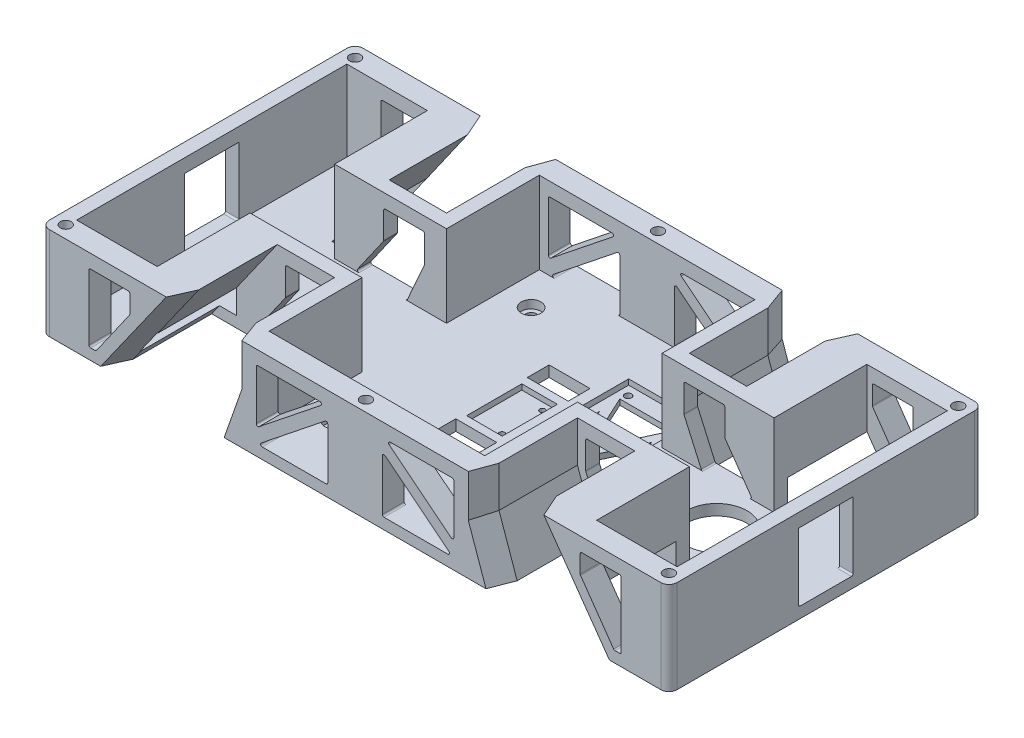
from build123d import *

# Parameters (mm, degrees)
EXTRUDE_1_DEPTH          = 5
EXTRUDE_3_DEPTH          = 35
EXTRUDE_6_DEPTH          = 37
EXTRUDE_7_DEPTH          = 37
SKETCH_6_W               = 20
SKETCH_6_H               = 25
CUT_EXTRUDE_3_DEPTH      = 240.64817963
CUT_EXTRUDE_1_DEPTH      = 133.027459265
CUT_EXTRUDE_1_DEPTH_BACK = 2
SKETCH_4_W               = 25.5
SKETCH_4_H               = 62.5
SKETCH_4_W_2             = 13
SKETCH_4_H_2             = 20.2
CUT_EXTRUDE_17_DEPTH     = 37
CUT_EXTRUDE_24_DEPTH     = 37
CHAMFER_2_SIZE           = 8.242432258
CHAMFER_2_SIZE_2         = 3
CUT_EXTRUDE_START        = -115
CUT_EXTRUDE_2_DEPTH      = 115
FILLET_1_R               = 3
SKETCH_8_R               = 2
CUT_EXTRUDE_4_DEPTH      = 10
SKETCH_12_R              = 1.25
SKETCH_12_R_2            = 1
CUT_EXTRUDE_8_DEPTH      = 2.5
SKETCH_14_R              = 11.1
SKETCH_14_R_2            = 2
SKETCH_14_W              = 15
SKETCH_14_H              = 8
CUT_EXTRUDE_9_DEPTH      = 133.027459265
SKETCH_19_R              = 3.6
CUT_EXTRUDE_12_DEPTH     = 3
FILLET_11_R              = 0.6
SKETCH_24_W              = 230
SKETCH_24_H              = 115
CUT_EXTRUDE_26_DEPTH     = 1


# Read off the part's stored shape, not the designer's step: 除料-伸長2
with BuildPart() as part:
    # 草圖1 → 填料-伸長1 (new body)
    with BuildSketch(Plane(origin=(0, 0, 0), x_dir=(1, 0, 0), z_dir=(0, 1, 0))):
        Polygon((-115, -57.5), (-65.5, -57.5), (-65.5, -20.5), (-44.5, -20.5), (-44.5, -57.5), (44.5, -57.5), (44.5, -20.5), (65.5, -20.5), (65.5, -57.5), (115, -57.5), (115, 57.5), (65.5, 57.5), (65.5, 20.5), (44.5, 20.5), (44.5, 57.5), (-44.5, 57.5), (-44.5, 20.5), (-65.5, 20.5), (-65.5, 57.5), (-115, 57.5), align=None)
    extrude(amount=EXTRUDE_1_DEPTH)

    # 草圖3 → 填料-伸長3 (add)
    with BuildSketch(Plane(origin=(0, 0, 0), x_dir=(1, 0, 0), z_dir=(0, 1, 0))):
        Polygon((115, 57.5), (65.5, 57.5), (65.5, 20.5), (44.5, 20.5), (44.5, 57.5), (-44.5, 57.5), (-44.5, 20.5), (-65.5, 20.5), (-65.5, 57.5), (-115, 57.5), (-115, -57.5), (-65.5, -57.5), (-65.5, -20.5), (-44.5, -20.5), (-44.5, -57.5), (44.5, -57.5), (44.5, -20.5), (65.5, -20.5), (65.5, -57.5), (115, -57.5), align=None)
        Polygon((110, 49.5), (80.5, 49.5), (80.5, 15.5), (39.5, 15.5), (39.5, 49.5), (-39.5, 49.5), (-39.5, 15.5), (-80.5, 15.5), (-80.5, 49.5), (-110, 49.5), (-110, -49.5), (-80.5, -49.5), (-80.5, -15.5), (-39.5, -15.5), (-39.5, -49.5), (39.5, -49.5), (39.5, -15.5), (80.5, -15.5), (80.5, -49.5), (110, -49.5), align=None, mode=Mode.SUBTRACT)
    extrude(amount=EXTRUDE_3_DEPTH)

    # 草圖18 → 填料-伸長6 (add)
    with BuildSketch(Plane.XY.offset(20.5)):
        Polygon((44.5, 0), (51.5, 0), (44.5, 20), align=None)
        Polygon((-44.5, 0), (-51.5, 0), (-44.5, 20), align=None)
    extrude(amount=EXTRUDE_6_DEPTH)

    # 草圖20 → 填料-伸長7 (add)
    with BuildSketch(Plane(origin=(0, 0, -20.5), x_dir=(-1, 0, 0), z_dir=(0, 0, -1))):
        Polygon((44.5, 20), (44.5, 0), (51.5, 0), align=None)
        Polygon((-44.5, 0), (-51.5, 0), (-44.5, 20), align=None)
    extrude(amount=EXTRUDE_7_DEPTH)

    # 草圖6 → 除料-伸長3 (cut, through all)
    with BuildSketch(Plane.ZY.offset(115)):
        with Locations((0, 17.5)):
            Rectangle(SKETCH_6_W, SKETCH_6_H)
    extrude(amount=-CUT_EXTRUDE_3_DEPTH, mode=Mode.SUBTRACT)

    # 草圖4 → 除料-伸長1 (cut, two sides: drawn at the far end of the back side and taken through both)
    with BuildSketch(Plane(origin=(0, 5, 0), x_dir=(1, 0, 0), z_dir=(0, 1, 0)).offset(-CUT_EXTRUDE_1_DEPTH_BACK)):
        with Locations((24.25, 0)):
            Rectangle(SKETCH_4_W, SKETCH_4_H)
        Rectangle(SKETCH_4_W_2, SKETCH_4_H_2)
    extrude(amount=CUT_EXTRUDE_1_DEPTH + CUT_EXTRUDE_1_DEPTH_BACK, mode=Mode.SUBTRACT)

    # 草圖21 → 除料-伸長17 (cut)
    with BuildSketch(Plane.XY.offset(57.5)):
        Polygon((65.5, 35), (90.217350695, 0), (65.5, -0.099274728), align=None)
        Polygon((-90.217350695, 0), (-65.5, -0.099274728), (-65.5, 35), align=None)
    extrude(amount=-CUT_EXTRUDE_17_DEPTH, mode=Mode.SUBTRACT)

    # 草圖22 → 除料-伸長24 (cut)
    with BuildSketch(Plane(origin=(0, 0, -20.5), x_dir=(-1, 0, 0), z_dir=(0, 0, -1))):
        Polygon((-65.5, 35), (-90.007263837, 0), (-65.5, 0), align=None)
        Polygon((90.007263837, 0), (65.5, 0), (65.5, 35), align=None)
    extrude(amount=CUT_EXTRUDE_24_DEPTH, mode=Mode.SUBTRACT)

    # 導角2
    # the kernel refuses this chamfer: 8.242432258, 3 mm, written as the material it takes off along each edge
    with BuildSketch(Plane(origin=(44.5, -1.382474348, 57.5), x_dir=(0.013184058198645527, 0, -0.9999130865277316), z_dir=(0, 1, 0))) as chamfer_2_piece_1_section:
        Polygon((CHAMFER_2_SIZE * 0.999913086572, CHAMFER_2_SIZE * 0.0131840581992), (-CHAMFER_2_SIZE_2 * 0.0131840581986, CHAMFER_2_SIZE_2 * 0.999913086528), (0, 0), align=None)
    chamfer_2_piece_1 = extrude(amount=57.764948696, mode=Mode.PRIVATE)
    chamfer_2_piece_1 = split(chamfer_2_piece_1, bisect_by=Plane(origin=(38.345395508, 37.584584264, 54.601686025), z_dir=(0.9438583563660173, 0.3303504247281064, 0)), keep=Keep.TOP, mode=Mode.PRIVATE)
    add(chamfer_2_piece_1, mode=Mode.SUBTRACT)
    with BuildSketch(Plane(origin=(58.563709483, -20.182027093, 57.5), x_dir=(0.012443883501607477, 0.004355359225562621, -0.9999130865277316), z_dir=(-0.3303504247281064, 0.9438583563660173, 0))) as chamfer_2_piece_2_section:
        Polygon((CHAMFER_2_SIZE * 0.999913086572, CHAMFER_2_SIZE * 0.0131840581992), (-CHAMFER_2_SIZE_2 * 0.0131840581986, CHAMFER_2_SIZE_2 * 0.999913086528), (0, 0), align=None)
    chamfer_2_piece_2 = extrude(amount=63.954568797, mode=Mode.PRIVATE)
    chamfer_2_piece_2 = split(chamfer_2_piece_2, bisect_by=Plane(origin=(44.5, -1.565243843, 54.613777726), z_dir=(1, 0, 0)), keep=Keep.TOP, mode=Mode.PRIVATE)
    add(chamfer_2_piece_2, mode=Mode.SUBTRACT)
    with BuildSketch(Plane(origin=(-58.563709483, -20.182027093, 57.5), x_dir=(0.939217747619894, -0.3287262116669632, 0.09904090225204963), z_dir=(0.3303504247281064, 0.9438583563660173, 0))) as chamfer_2_piece_3_section:
        Polygon((CHAMFER_2_SIZE_2 * 0.995083363182, CHAMFER_2_SIZE_2 * 0.099040902252), (-CHAMFER_2_SIZE * 0.0990409022564, CHAMFER_2_SIZE * 0.995083363226), (0, 0), align=None)
    chamfer_2_piece_3 = extrude(amount=63.954568797, mode=Mode.PRIVATE)
    chamfer_2_piece_3 = split(chamfer_2_piece_3, bisect_by=Plane(origin=(-44.5, -1.565243843, 54.613777726), z_dir=(-1, 0, 0)), keep=Keep.TOP, mode=Mode.PRIVATE)
    add(chamfer_2_piece_3, mode=Mode.SUBTRACT)
    with BuildSketch(Plane(origin=(-44.5, -1.382474348, 57.5), x_dir=(0.9950833631817487, 0, 0.0990409022520496), z_dir=(0, 1, 0))) as chamfer_2_piece_4_section:
        Polygon((CHAMFER_2_SIZE_2 * 0.995083363182, CHAMFER_2_SIZE_2 * 0.099040902252), (-CHAMFER_2_SIZE * 0.0990409022564, CHAMFER_2_SIZE * 0.995083363226), (0, 0), align=None)
    chamfer_2_piece_4 = extrude(amount=57.764948696, mode=Mode.PRIVATE)
    chamfer_2_piece_4 = split(chamfer_2_piece_4, bisect_by=Plane(origin=(-38.345395508, 37.584584264, 54.601686025), z_dir=(-0.9438583563660173, 0.3303504247281064, 0)), keep=Keep.TOP, mode=Mode.PRIVATE)
    add(chamfer_2_piece_4, mode=Mode.SUBTRACT)
    with BuildSketch(Plane(origin=(-44.5, 56.382474348, -57.5), x_dir=(-0.013184058198645527, 0, 0.9999130865277316), z_dir=(0, -1, 0))) as chamfer_2_piece_5_section:
        Polygon((CHAMFER_2_SIZE * 0.999913086572, -CHAMFER_2_SIZE * 0.0131840581992), (-CHAMFER_2_SIZE_2 * 0.0131840581986, -CHAMFER_2_SIZE_2 * 0.999913086528), (0, 0), align=None)
    chamfer_2_piece_5 = extrude(amount=57.764948696, mode=Mode.PRIVATE)
    chamfer_2_piece_5 = split(chamfer_2_piece_5, bisect_by=Plane(origin=(-38.345395508, 37.584584264, -54.601686025), z_dir=(-0.9438583563660174, 0.33035042472810616, -3.991974397037747e-14)), keep=Keep.TOP, mode=Mode.PRIVATE)
    add(chamfer_2_piece_5, mode=Mode.SUBTRACT)
    with BuildSketch(Plane(origin=(44.5, 56.382474348, -57.5), x_dir=(-0.9950833631817487, 0, -0.0990409022520496), z_dir=(0, -1, 0))) as chamfer_2_piece_6_section:
        Polygon((CHAMFER_2_SIZE_2 * 0.995083363182, -CHAMFER_2_SIZE_2 * 0.099040902252), (-CHAMFER_2_SIZE * 0.0990409022564, -CHAMFER_2_SIZE * 0.995083363226), (0, 0), align=None)
    chamfer_2_piece_6 = extrude(amount=57.764948696, mode=Mode.PRIVATE)
    chamfer_2_piece_6 = split(chamfer_2_piece_6, bisect_by=Plane(origin=(38.345395508, 37.584584264, -54.601686025), z_dir=(0.9438583563660174, 0.33035042472810616, 3.991974397037747e-14)), keep=Keep.TOP, mode=Mode.PRIVATE)
    add(chamfer_2_piece_6, mode=Mode.SUBTRACT)
    with BuildSketch(Plane(origin=(-58.563709483, -20.182027093, -57.5), x_dir=(-0.012443883501650018, 0.004355359225562704, 0.999913086527731), z_dir=(0.33035042472810616, 0.9438583563660174, 1.3971910389632114e-14))) as chamfer_2_piece_7_section:
        Polygon((CHAMFER_2_SIZE * 0.999913086572, CHAMFER_2_SIZE * 0.0131840581992), (-CHAMFER_2_SIZE_2 * 0.0131840581987, CHAMFER_2_SIZE_2 * 0.999913086528), (0, 0), align=None)
    chamfer_2_piece_7 = extrude(amount=63.954568797, mode=Mode.PRIVATE)
    chamfer_2_piece_7 = split(chamfer_2_piece_7, bisect_by=Plane(origin=(-44.5, -1.565243843, -54.613777726), z_dir=(-1, 0, 0)), keep=Keep.TOP, mode=Mode.PRIVATE)
    add(chamfer_2_piece_7, mode=Mode.SUBTRACT)
    with BuildSketch(Plane(origin=(58.563709483, -20.182027093, -57.5), x_dir=(-0.9392177476198934, -0.3287262116669642, -0.09904090225205214), z_dir=(-0.33035042472810616, 0.9438583563660174, -1.3971910389632114e-14))) as chamfer_2_piece_8_section:
        Polygon((CHAMFER_2_SIZE_2 * 0.995083363182, CHAMFER_2_SIZE_2 * 0.0990409022521), (-CHAMFER_2_SIZE * 0.0990409022564, CHAMFER_2_SIZE * 0.995083363226), (0, 0), align=None)
    chamfer_2_piece_8 = extrude(amount=63.954568797, mode=Mode.PRIVATE)
    chamfer_2_piece_8 = split(chamfer_2_piece_8, bisect_by=Plane(origin=(44.5, -1.565243843, -54.613777726), z_dir=(1, 0, 0)), keep=Keep.TOP, mode=Mode.PRIVATE)
    add(chamfer_2_piece_8, mode=Mode.SUBTRACT)
    with BuildSketch(Plane(origin=(53.165266834, 52.466097646, 57.5), x_dir=(0.8128256302022223, 0.5740256044528502, 0.09904090225204966), z_dir=(0.5768618245384194, -0.8168417443974113, 0))) as chamfer_2_piece_9:
        Polygon((CHAMFER_2_SIZE_2 * 0.995083363182, -CHAMFER_2_SIZE_2 * 0.099040902252), (-CHAMFER_2_SIZE * 0.0990409022564, -CHAMFER_2_SIZE * 0.995083363226), (0, 0), align=None)
    extrude(amount=85.61290577, mode=Mode.SUBTRACT)
    with BuildSketch(Plane(origin=(-53.165266834, 52.466097646, 57.5), x_dir=(-0.8128256302022223, 0.5740256044528503, 0.09904090225204966), z_dir=(-0.5768618245384196, -0.8168417443974112, 0))) as chamfer_2_piece_10:
        Polygon((CHAMFER_2_SIZE_2 * 0.995083363182, CHAMFER_2_SIZE_2 * 0.099040902252), (-CHAMFER_2_SIZE * 0.0990409022564, CHAMFER_2_SIZE * 0.995083363226), (0, 0), align=None)
    extrude(amount=85.61290577, mode=Mode.SUBTRACT)
    with BuildSketch(Plane(origin=(-53.235516563, 52.515497574, -57.5), x_dir=(-0.8151245711882923, 0.5707563693260028, -0.09904090225206051), z_dir=(-0.5735764363510504, -0.8191520442889889, 2.4258962515024057e-14))) as chamfer_2_piece_11:
        Polygon((CHAMFER_2_SIZE_2 * 0.995083363182, -CHAMFER_2_SIZE_2 * 0.0990409022521), (-CHAMFER_2_SIZE * 0.0990409022565, -CHAMFER_2_SIZE * 0.995083363226), (0, 0), align=None)
    extrude(amount=85.492059303, mode=Mode.SUBTRACT)
    with BuildSketch(Plane(origin=(53.235516563, 52.515497574, -57.5), x_dir=(-0.010799748225404552, -0.007562065118224895, 0.999913086527732), z_dir=(0.5735764363510502, -0.819152044288989, -2.4258962515024048e-14))) as chamfer_2_piece_12:
        Polygon((CHAMFER_2_SIZE * 0.999913086572, -CHAMFER_2_SIZE * 0.0131840581992), (-CHAMFER_2_SIZE_2 * 0.0131840581986, -CHAMFER_2_SIZE_2 * 0.999913086528), (0, 0), align=None)
    extrude(amount=85.492059303, mode=Mode.SUBTRACT)
    with BuildSketch(Plane(origin=(58.563709483, -20.182027093, 57.5), x_dir=(0.012443883501607477, 0.004355359225562621, -0.9999130865277316), z_dir=(-0.3303504247281064, 0.9438583563660173, 0))) as chamfer_2_piece_13a_section:
        Polygon((CHAMFER_2_SIZE * 0.999913086572, CHAMFER_2_SIZE * 0.0131840581992), (-CHAMFER_2_SIZE_2 * 0.0131840581986, CHAMFER_2_SIZE_2 * 0.999913086528), (0, 0), align=None)
    chamfer_2_piece_13a = extrude(amount=63.954568797, mode=Mode.PRIVATE)
    chamfer_2_piece_13a = split(chamfer_2_piece_13a, bisect_by=Plane(origin=(44.5, 28.418638208, 54.789321516), z_dir=(-1, 0, 0)), keep=Keep.TOP, mode=Mode.PRIVATE)
    with BuildSketch(Plane(origin=(44.5, -1.382474348, 57.5), x_dir=(0.013184058198645527, 0, -0.9999130865277316), z_dir=(0, 1, 0))) as chamfer_2_piece_13b_section:
        Polygon((CHAMFER_2_SIZE * 0.999913086572, CHAMFER_2_SIZE * 0.0131840581992), (-CHAMFER_2_SIZE_2 * 0.0131840581986, CHAMFER_2_SIZE_2 * 0.999913086528), (0, 0), align=None)
    chamfer_2_piece_13b = extrude(amount=57.764948696, mode=Mode.PRIVATE)
    chamfer_2_piece_13b = split(chamfer_2_piece_13b, bisect_by=Plane(origin=(47.281100708, 12.053997978, 54.789321516), z_dir=(-0.9438583563660173, -0.3303504247281064, 0)), keep=Keep.TOP, mode=Mode.PRIVATE)
    chamfer_2_piece_13 = chamfer_2_piece_13a & chamfer_2_piece_13b
    add(chamfer_2_piece_13, mode=Mode.SUBTRACT)
    with BuildSketch(Plane(origin=(-44.5, -1.382474348, 57.5), x_dir=(0.9950833631817487, 0, 0.0990409022520496), z_dir=(0, 1, 0))) as chamfer_2_piece_14a_section:
        Polygon((CHAMFER_2_SIZE_2 * 0.995083363182, CHAMFER_2_SIZE_2 * 0.099040902252), (-CHAMFER_2_SIZE * 0.0990409022564, CHAMFER_2_SIZE * 0.995083363226), (0, 0), align=None)
    chamfer_2_piece_14a = extrude(amount=57.764948696, mode=Mode.PRIVATE)
    chamfer_2_piece_14a = split(chamfer_2_piece_14a, bisect_by=Plane(origin=(-47.281100708, 12.053997978, 54.789321516), z_dir=(0.9438583563660173, -0.3303504247281064, 0)), keep=Keep.TOP, mode=Mode.PRIVATE)
    with BuildSketch(Plane(origin=(-58.563709483, -20.182027093, 57.5), x_dir=(0.939217747619894, -0.3287262116669632, 0.09904090225204963), z_dir=(0.3303504247281064, 0.9438583563660173, 0))) as chamfer_2_piece_14b_section:
        Polygon((CHAMFER_2_SIZE_2 * 0.995083363182, CHAMFER_2_SIZE_2 * 0.099040902252), (-CHAMFER_2_SIZE * 0.0990409022564, CHAMFER_2_SIZE * 0.995083363226), (0, 0), align=None)
    chamfer_2_piece_14b = extrude(amount=63.954568797, mode=Mode.PRIVATE)
    chamfer_2_piece_14b = split(chamfer_2_piece_14b, bisect_by=Plane(origin=(-44.5, 28.418638208, 54.789321516), z_dir=(1, 0, 0)), keep=Keep.TOP, mode=Mode.PRIVATE)
    chamfer_2_piece_14 = chamfer_2_piece_14a & chamfer_2_piece_14b
    add(chamfer_2_piece_14, mode=Mode.SUBTRACT)
    with BuildSketch(Plane(origin=(-58.563709483, -20.182027093, -57.5), x_dir=(-0.012443883501650018, 0.004355359225562704, 0.999913086527731), z_dir=(0.33035042472810616, 0.9438583563660174, 1.3971910389632114e-14))) as chamfer_2_piece_15a_section:
        Polygon((CHAMFER_2_SIZE * 0.999913086572, CHAMFER_2_SIZE * 0.0131840581992), (-CHAMFER_2_SIZE_2 * 0.0131840581987, CHAMFER_2_SIZE_2 * 0.999913086528), (0, 0), align=None)
    chamfer_2_piece_15a = extrude(amount=63.954568797, mode=Mode.PRIVATE)
    chamfer_2_piece_15a = split(chamfer_2_piece_15a, bisect_by=Plane(origin=(-44.5, 28.418638208, -54.789321516), z_dir=(1, 0, 0)), keep=Keep.TOP, mode=Mode.PRIVATE)
    with BuildSketch(Plane(origin=(-44.5, 56.382474348, -57.5), x_dir=(-0.013184058198645527, 0, 0.9999130865277316), z_dir=(0, -1, 0))) as chamfer_2_piece_15b_section:
        Polygon((CHAMFER_2_SIZE * 0.999913086572, -CHAMFER_2_SIZE * 0.0131840581992), (-CHAMFER_2_SIZE_2 * 0.0131840581986, -CHAMFER_2_SIZE_2 * 0.999913086528), (0, 0), align=None)
    chamfer_2_piece_15b = extrude(amount=57.764948696, mode=Mode.PRIVATE)
    chamfer_2_piece_15b = split(chamfer_2_piece_15b, bisect_by=Plane(origin=(-47.281100708, 12.053997978, -54.789321516), z_dir=(0.9438583563660174, -0.33035042472810616, 3.991974397037747e-14)), keep=Keep.TOP, mode=Mode.PRIVATE)
    chamfer_2_piece_15 = chamfer_2_piece_15a & chamfer_2_piece_15b
    add(chamfer_2_piece_15, mode=Mode.SUBTRACT)
    with BuildSketch(Plane(origin=(44.5, 56.382474348, -57.5), x_dir=(-0.9950833631817487, 0, -0.0990409022520496), z_dir=(0, -1, 0))) as chamfer_2_piece_16a_section:
        Polygon((CHAMFER_2_SIZE_2 * 0.995083363182, -CHAMFER_2_SIZE_2 * 0.099040902252), (-CHAMFER_2_SIZE * 0.0990409022564, -CHAMFER_2_SIZE * 0.995083363226), (0, 0), align=None)
    chamfer_2_piece_16a = extrude(amount=57.764948696, mode=Mode.PRIVATE)
    chamfer_2_piece_16a = split(chamfer_2_piece_16a, bisect_by=Plane(origin=(47.281100708, 12.053997978, -54.789321516), z_dir=(-0.9438583563660174, -0.33035042472810616, -3.991974397037747e-14)), keep=Keep.TOP, mode=Mode.PRIVATE)
    with BuildSketch(Plane(origin=(58.563709483, -20.182027093, -57.5), x_dir=(-0.9392177476198934, -0.3287262116669642, -0.09904090225205214), z_dir=(-0.33035042472810616, 0.9438583563660174, -1.3971910389632114e-14))) as chamfer_2_piece_16b_section:
        Polygon((CHAMFER_2_SIZE_2 * 0.995083363182, CHAMFER_2_SIZE_2 * 0.0990409022521), (-CHAMFER_2_SIZE * 0.0990409022564, CHAMFER_2_SIZE * 0.995083363226), (0, 0), align=None)
    chamfer_2_piece_16b = extrude(amount=63.954568797, mode=Mode.PRIVATE)
    chamfer_2_piece_16b = split(chamfer_2_piece_16b, bisect_by=Plane(origin=(44.5, 28.418638208, -54.789321516), z_dir=(-1, 0, 0)), keep=Keep.TOP, mode=Mode.PRIVATE)
    chamfer_2_piece_16 = chamfer_2_piece_16a & chamfer_2_piece_16b
    add(chamfer_2_piece_16, mode=Mode.SUBTRACT)

    # 除料-伸長2 outline → 除料-伸長2 (cut)
    with BuildSketch(Plane.XY.offset(57.5).offset(CUT_EXTRUDE_START)):
        Polygon((97.5, 5), (97.5, 30), (82.5, 30), (82.5, 22.738709418), (94.920778053, 5), align=None)
        Polygon((-97.5, 5), (-94.920778053, 5), (-82.5, 22.738709418), (-82.5, 30), (-97.5, 30), align=None)
        Polygon((-72.725151709, 5), (-53.997829451, 5), (-47.5, 19.603030032), (-47.5, 30), (-62.5, 30), (-62.5, 19.603030032), align=None)
        Polygon((-35.738412279, 5), (-10, 5), (-10, 25.533799093), align=None)
        Polygon((10, 5), (35.738412279, 5), (10, 25.533799093), align=None)
        Polygon((53.997829451, 5), (72.725151709, 5), (62.5, 19.603030032), (62.5, 30), (47.5, 30), (47.5, 19.603030032), align=None)
        Polygon((-11.182387478, 30), (-36.182387478, 30), (-36.182387478, 10.055297438), align=None)
        Polygon((36.182387478, 10.055297438), (36.182387478, 30), (11.182387478, 30), align=None)
    extrude(amount=CUT_EXTRUDE_2_DEPTH, mode=Mode.SUBTRACT)

    # 圓角1
    fillet_1_edges = [part.edges().sort_by_distance(p)[0] for p in [
        (115, 17.5, -57.5),
        (115, 17.5, 57.5),
        (-115, 17.5, 57.5),
        (-115, 17.5, -57.5),
    ]]
    fillet(fillet_1_edges, radius=FILLET_1_R)

    # 草圖8 → 除料-伸長4 (cut)
    with BuildSketch(Plane(origin=(0, 35, 0), x_dir=(1, 0, 0), z_dir=(0, 1, 0))):
        with Locations(Location((-110.5, 53, 0), (0, 0, 270))):
            Circle(SKETCH_8_R)
        with Locations(Location((0, 53.5, 0), (0, 0, 270))):
            Circle(SKETCH_8_R)
        with Locations(Location((110.5, 53, 0), (0, 0, 90))):
            Circle(SKETCH_8_R)
        with Locations(Location((110.5, -53, 0), (0, 0, 270))):
            Circle(SKETCH_8_R)
        with Locations(Location((0, -53.5, 0), (0, 0, 90))):
            Circle(SKETCH_8_R)
        with Locations(Location((-110.5, -53, 0), (0, 0, 90))):
            Circle(SKETCH_8_R)
    extrude(amount=-CUT_EXTRUDE_4_DEPTH, mode=Mode.SUBTRACT)

    # 草圖12 → 除料-伸長8 (cut, symmetric)
    with BuildSketch(Plane(origin=(0, 3, 0), x_dir=(1, 0, 0), z_dir=(0, 1, 0))):
        with Locations(Location((33.7, 27.75, 0), (0, 0, 270))):
            Circle(SKETCH_12_R)
        with Locations(Location((14.8, 27.75, 0), (0, 0, 270))):
            Circle(SKETCH_12_R)
        with Locations(Location((33.7, -27.75, 0), (0, 0, 270))):
            Circle(SKETCH_12_R)
        with Locations(Location((14.8, -27.75, 0), (0, 0, 270))):
            Circle(SKETCH_12_R)
        with Locations(Location((3.77, -7.42, 0), (0, 0, 270))):
            Circle(SKETCH_12_R_2)
        with Locations(Location((3.77, 7.42, 0), (0, 0, 90))):
            Circle(SKETCH_12_R_2)
    extrude(amount=CUT_EXTRUDE_8_DEPTH, both=True, mode=Mode.SUBTRACT)

    # 草圖14 → 除料-伸長9 (cut, through all)
    with BuildSketch(Plane(origin=(0, 5, 0), x_dir=(1, 0, 0), z_dir=(0, 1, 0))):
        with Locations(Location((75, 0, 0), (0, 0, 270))):
            Circle(SKETCH_14_R)
        with Locations(Location((-29, 36, 0), (0, 0, 270))):
            Circle(SKETCH_14_R_2)
        with Locations(Location((-96, 0, 0), (0, 0, 270))):
            Circle(SKETCH_14_R_2)
        with Locations(Location((-29, -36, 0), (0, 0, 90))):
            Circle(SKETCH_14_R_2)
        with Locations(Location((29, -36, 0), (0, 0, 270))):
            Circle(SKETCH_14_R_2)
        with Locations(Location((96, 0, 0), (0, 0, 90))):
            Circle(SKETCH_14_R_2)
        with Locations(Location((29, 36, 0), (0, 0, 90))):
            Circle(SKETCH_14_R_2)
        with Locations((0, 17.1)):
            Rectangle(SKETCH_14_W, SKETCH_14_H)
        with Locations((0, -17.1)):
            Rectangle(SKETCH_14_W, SKETCH_14_H)
        Polygon((34.25, 25.25), (24.25, 3.57992013), (14.25, 25.25), align=None)
        Polygon((14.5, 17.548407744), (22.597989416, 0), (14.5, -17.548407744), align=None)
        Polygon((34, 17.548407744), (25.902010584, 0), (34, -17.548407744), align=None)
        Polygon((24.25, -3.57992013), (14.25, -25.25), (34.25, -25.25), align=None)
    extrude(amount=-CUT_EXTRUDE_9_DEPTH, mode=Mode.SUBTRACT)

    # 草圖19 → 除料-伸長12 (cut)
    with BuildSketch(Plane(origin=(0, 5, 0), x_dir=(1, 0, 0), z_dir=(0, 1, 0))):
        with Locations(Location((-29, 36, 0), (0, 0, 270))):
            Circle(SKETCH_19_R)
        with Locations(Location((-96, 0, 0), (0, 0, 270))):
            Circle(SKETCH_19_R)
        with Locations(Location((-29, -36, 0), (0, 0, 90))):
            Circle(SKETCH_19_R)
        with Locations(Location((29, -36, 0), (0, 0, 270))):
            Circle(SKETCH_19_R)
        with Locations(Location((96, 0, 0), (0, 0, 90))):
            Circle(SKETCH_19_R)
        with Locations(Location((29, 36, 0), (0, 0, 90))):
            Circle(SKETCH_19_R)
    extrude(amount=-CUT_EXTRUDE_12_DEPTH, mode=Mode.SUBTRACT)

    # 圓角11
    fillet_11_edges = [part.edges().sort_by_distance(p)[0] for p in [
        (112.5, 5, 10),
        (112.5, 5, -10),
        (-112.5, 5, -10),
        (-112.5, 5, 10),
        (82.5, 30, -53.5),
        (97.5, 30, -53.5),
        (97.5, 5, -53.5),
        (94.920778053, 5, -53.5),
        (82.5, 22.738709418, -53.5),
        (82.5, 30, 53.5),
        (97.5, 30, 53.5),
        (97.5, 5, 53.5),
        (94.920778053, 5, 53.5),
        (82.5, 22.738709418, 53.5),
        (36.182387478, 30, -53.5),
        (36.182387478, 10.055297438, -53.5),
        (11.182387478, 30, -53.5),
        (36.182387478, 30, 53.5),
        (36.182387478, 10.055297438, 53.5),
        (11.182387478, 30, 53.5),
        (10, 5, -53.5),
        (10, 25.533799093, -53.5),
        (35.738412279, 5, -53.5),
        (35.738412279, 5, 53.5),
        (10, 5, 53.5),
        (10, 25.533799093, 53.5),
        (-35.738412279, 5, -53.5),
        (-10, 25.533799093, -53.5),
        (-10, 5, -53.5),
        (-35.738412279, 5, 53.5),
        (-10, 25.533799093, 53.5),
        (-10, 5, 53.5),
        (-97.5, 30, -53.5),
        (-82.5, 30, -53.5),
        (-82.5, 22.738709418, -53.5),
        (-94.920778053, 5, -53.5),
        (-97.5, 5, -53.5),
        (-97.5, 30, 53.5),
        (-82.5, 30, 53.5),
        (-82.5, 22.738709418, 53.5),
        (-94.920778053, 5, 53.5),
        (-97.5, 5, 53.5),
        (-72.725151709, 5, -18),
        (-72.725151709, 5, 18),
        (-62.5, 19.603030032, -18),
        (-62.5, 19.603030032, 18),
        (-62.5, 30, -18),
        (-62.5, 30, 18),
        (-47.5, 30, -18),
        (-47.5, 30, 18),
        (-47.5, 19.603030032, -18),
        (-47.5, 19.603030032, 18),
        (-53.997829451, 5, -18),
        (-53.997829451, 5, 18),
        (53.997829451, 5, -18),
        (53.997829451, 5, 18),
        (47.5, 19.603030032, -18),
        (47.5, 19.603030032, 18),
        (47.5, 30, -18),
        (47.5, 30, 18),
        (62.5, 30, -18),
        (62.5, 30, 18),
        (62.5, 19.603030032, -18),
        (62.5, 19.603030032, 18),
        (72.725151709, 5, -18),
        (72.725151709, 5, 18),
        (-36.182387478, 30, -53.5),
        (-11.182387478, 30, -53.5),
        (-36.182387478, 10.055297438, -53.5),
        (-36.182387478, 30, 53.5),
        (-11.182387478, 30, 53.5),
        (-36.182387478, 10.055297438, 53.5),
    ]]
    fillet(fillet_11_edges, radius=FILLET_11_R)

    # 草圖24 → 除料-伸長26 (cut)
    with BuildSketch(Plane.XZ):
        Rectangle(SKETCH_24_W, SKETCH_24_H)
    extrude(amount=-CUT_EXTRUDE_26_DEPTH, mode=Mode.SUBTRACT)


solid = part.part
